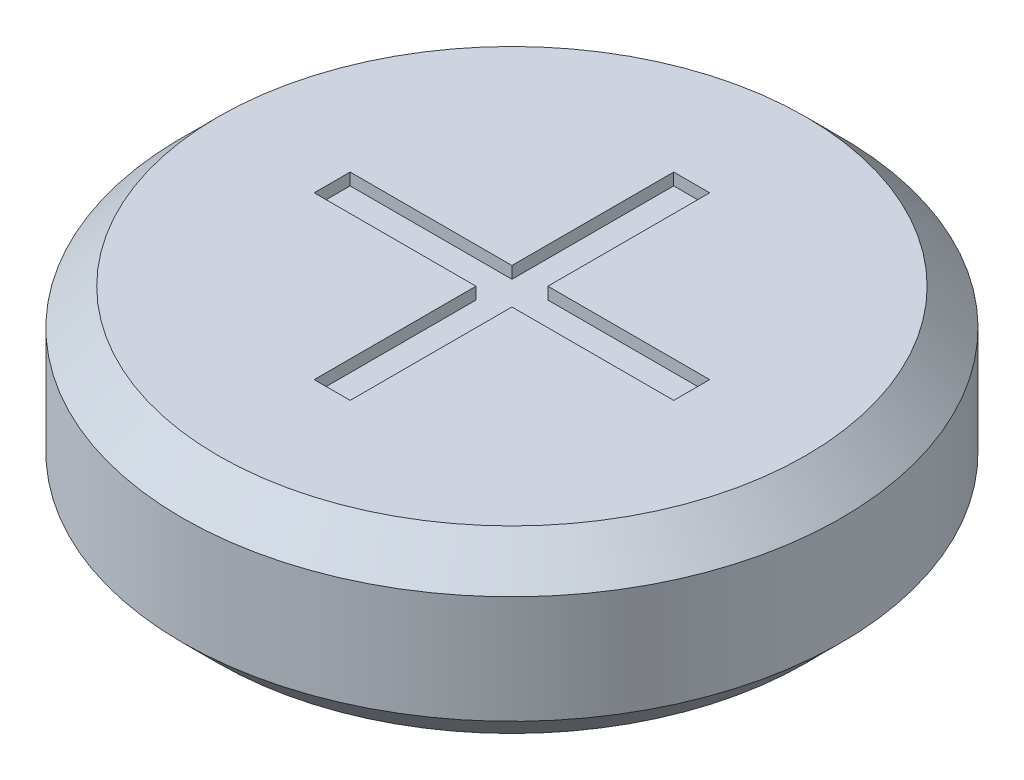
from build123d import *

# Parameters (mm, degrees)
SKETCH1_R           = 27.5
BOSS_EXTRUDE1_DEPTH = 15
CHAMFER1_SIZE       = 3
CUT_EXTRUDE1_DEPTH  = 1
SKETCH3_W           = 30
SKETCH3_H           = 3
CUT_EXTRUDE2_DEPTH  = 1


with BuildPart() as part:
    # Sketch1 → Boss-Extrude1 (new body)
    with BuildSketch(Plane(origin=(0, 0, 0), x_dir=(1, 0, 0), z_dir=(0, 1, 0))):
        Circle(SKETCH1_R)
    extrude(amount=BOSS_EXTRUDE1_DEPTH)

    # Chamfer1
    chamfer1_edges = [part.edges().sort_by_distance(p)[0] for p in [
        (-27.5, 0, 0),
        (-27.5, 15, 0),
    ]]
    chamfer(chamfer1_edges, length=CHAMFER1_SIZE)

    # Sketch2 → Cut-Extrude1 (cut)
    with BuildSketch(Plane(origin=(0, 15, 0), x_dir=(1, 0, 0), z_dir=(0, 1, 0))):
        Polygon((-1.5, 15), (1.5, 15), (1.5, 1.5), (15, 1.5), (15, -1.5), (1.5, -1.5), (1.5, -15), (-1.5, -15), (-1.5, -1.5), (-15, -1.5), (-15, 1.5), (-1.5, 1.5), align=None)
    extrude(amount=-CUT_EXTRUDE1_DEPTH, mode=Mode.SUBTRACT)

    # Sketch3 → Cut-Extrude2 (cut)
    with BuildSketch(Plane.XZ):
        Rectangle(SKETCH3_W, SKETCH3_H)
    extrude(amount=-CUT_EXTRUDE2_DEPTH, mode=Mode.SUBTRACT)


solid = part.part
